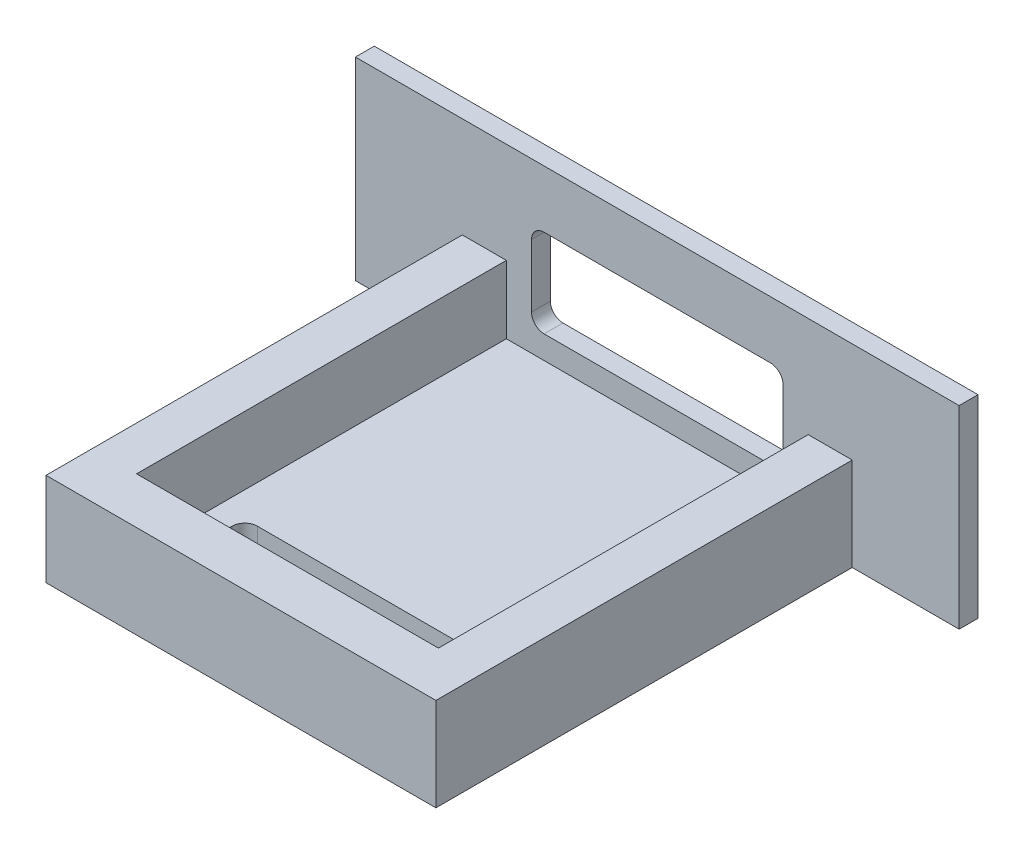
from build123d import *

# Parameters (mm, degrees)
SKETCH4_W           = 13.5
SKETCH4_H           = 15.3
SKETCH4_W_2         = 12
SKETCH4_H_2         = 13.8
BOSS_EXTRUDE1_DEPTH = 2.7
SKETCH5_W           = 13.5
SKETCH5_H           = 15.3
BOSS_EXTRUDE2_DEPTH = 1
SKETCH6_W           = 24
SKETCH6_H           = 0.75
BOSS_EXTRUDE3_DEPTH = 4
CUT_EXTRUDE1_REACH  = 22.566
SKETCH8_W           = 5.25
SKETCH8_H           = 0.75
BOSS_EXTRUDE4_DEPTH = 3.7
SKETCH9_W           = 5.25
SKETCH9_H           = 0.75
BOSS_EXTRUDE5_DEPTH = 3.7
SKETCH10_W          = 13.5
SKETCH10_H          = 3.7
BOSS_EXTRUDE6_DEPTH = 2
CHAMFER1_SIZE       = 2.7
CHAMFER1_SIZE_2     = 0.9
SKETCH11_W          = 16.55
SKETCH11_H          = 3.7
BOSS_EXTRUDE7_DEPTH = 1
SKETCH12_W          = 16.55
SKETCH12_H          = 3.7
BOSS_EXTRUDE8_DEPTH = 1
CUT_EXTRUDE2_REACH  = 24.114


with BuildPart() as part:
    # Sketch4 → Boss-Extrude1 (new body)
    with BuildSketch(Plane(origin=(0, 0, 0), x_dir=(1, 0, 0), z_dir=(0, 1, 0))):
        with Locations((0, -7.674098898)):
            Rectangle(SKETCH4_W, SKETCH4_H)
        with Locations((0, -7.674098898)):
            Rectangle(SKETCH4_W_2, SKETCH4_H_2, mode=Mode.SUBTRACT)
    extrude(amount=BOSS_EXTRUDE1_DEPTH)

    # Sketch5 → Boss-Extrude2 (add)
    with BuildSketch(Plane.XZ):
        with Locations((0, 7.674098898)):
            Rectangle(SKETCH5_W, SKETCH5_H)
    extrude(amount=BOSS_EXTRUDE2_DEPTH)

    # Sketch6 → Boss-Extrude3 (add)
    with BuildSketch(Plane(origin=(0, 2.7, 0), x_dir=(1, 0, 0), z_dir=(0, 1, 0))):
        with Locations((0, -0.399098898)):
            Rectangle(SKETCH6_W, SKETCH6_H)
    extrude(amount=BOSS_EXTRUDE3_DEPTH)

    # Sketch7 → Cut-Extrude1 (cut, up to next)
    with BuildSketch(Plane(origin=(0, 0, 0.024098898), x_dir=(-1, 0, 0), z_dir=(0, 0, -1)), mode=Mode.PRIVATE) as cut_extrude1_sk1:
        with BuildLine():
            Line((-4.5, 0.919), (4.5, 0.919))
            ThreePointArc((4.5, 0.919), (4.853553391, 1.065446609), (5, 1.419))
            Line((5, 1.419), (5, 3.919))
            ThreePointArc((5, 3.919), (4.853553391, 4.272553391), (4.5, 4.419))
            Line((4.5, 4.419), (-4.5, 4.419))
            ThreePointArc((-4.5, 4.419), (-4.853553391, 4.272553391), (-5, 3.919))
            Line((-5, 3.919), (-5, 1.419))
            ThreePointArc((-5, 1.419), (-4.853553391, 1.065446609), (-4.5, 0.919))
        make_face()
    cut_extrude1_tool1 = extrude(cut_extrude1_sk1.sketch, amount=-CUT_EXTRUDE1_REACH, mode=Mode.PRIVATE) & part.part
    add(cut_extrude1_tool1.solids().sort_by_distance((0, 2.669, 0.024099))[0], mode=Mode.SUBTRACT)

    # Sketch8 → Boss-Extrude4 (add)
    with BuildSketch(Plane.XZ.offset(-2.7)):
        with Locations((9.375, 0.399098898)):
            Rectangle(SKETCH8_W, SKETCH8_H)
    extrude(amount=BOSS_EXTRUDE4_DEPTH)

    # Sketch9 → Boss-Extrude5 (add)
    with BuildSketch(Plane.XZ.offset(-2.7)):
        with Locations((-9.375, 0.399098898)):
            Rectangle(SKETCH9_W, SKETCH9_H)
    extrude(amount=BOSS_EXTRUDE5_DEPTH)

    # Sketch10 → Boss-Extrude6 (add)
    with BuildSketch(Plane.XY.offset(15.324098898)):
        with Locations((0, 0.85)):
            Rectangle(SKETCH10_W, SKETCH10_H)
    extrude(amount=BOSS_EXTRUDE6_DEPTH)

    # Chamfer1
    # the kernel refuses this chamfer: 2.7, 0.9 mm, written as the material it takes off along each edge
    with BuildSketch(Plane(origin=(-6, 2.7, 14.574098898), x_dir=(0, -0.9999257509361695, -0.012185754582199112), z_dir=(1, 0, 0))) as chamfer1_piece_1:
        Polygon((CHAMFER1_SIZE * 0.999925750936, -CHAMFER1_SIZE * 0.0121857545822), (-CHAMFER1_SIZE_2 * 0.0121857545822, -CHAMFER1_SIZE_2 * 0.999925750936), (0, 0), align=None)
    extrude(amount=12, mode=Mode.SUBTRACT)

    # Sketch11 → Boss-Extrude7 (add)
    with BuildSketch(Plane(origin=(6.75, 0, 0), x_dir=(0, 0, -1), z_dir=(1, 0, 0))):
        with Locations((-9.049098898, 0.85)):
            Rectangle(SKETCH11_W, SKETCH11_H)
    extrude(amount=BOSS_EXTRUDE7_DEPTH)

    # Sketch12 → Boss-Extrude8 (add)
    with BuildSketch(Plane.ZY.offset(6.75)):
        with Locations((9.049098898, 0.85)):
            Rectangle(SKETCH12_W, SKETCH12_H)
    extrude(amount=BOSS_EXTRUDE8_DEPTH)

    # Sketch13 → Cut-Extrude2 (cut, up to next)
    with BuildSketch(Plane(origin=(0, 0, 0), x_dir=(1, 0, 0), z_dir=(0, 1, 0)), mode=Mode.PRIVATE) as cut_extrude2_sk1:
        with BuildLine():
            Line((-4.5, -12.174098898), (4.5, -12.174098898))
            ThreePointArc((4.5, -12.174098898), (4.853553391, -12.320545507), (5, -12.674098898))
            Line((5, -12.674098898), (5, -13.074098898))
            ThreePointArc((5, -13.074098898), (4.853553391, -13.427652289), (4.5, -13.574098898))
            Line((4.5, -13.574098898), (-4.5, -13.574098898))
            ThreePointArc((-4.5, -13.574098898), (-4.853553391, -13.427652289), (-5, -13.074098898))
            Line((-5, -13.074098898), (-5, -12.674098898))
            ThreePointArc((-5, -12.674098898), (-4.853553391, -12.320545507), (-4.5, -12.174098898))
        make_face()
    cut_extrude2_tool1 = extrude(cut_extrude2_sk1.sketch, amount=-CUT_EXTRUDE2_REACH, mode=Mode.PRIVATE) & part.part
    add(cut_extrude2_tool1.solids().sort_by_distance((0, 0, 12.874099))[0], mode=Mode.SUBTRACT)


solid = part.part
